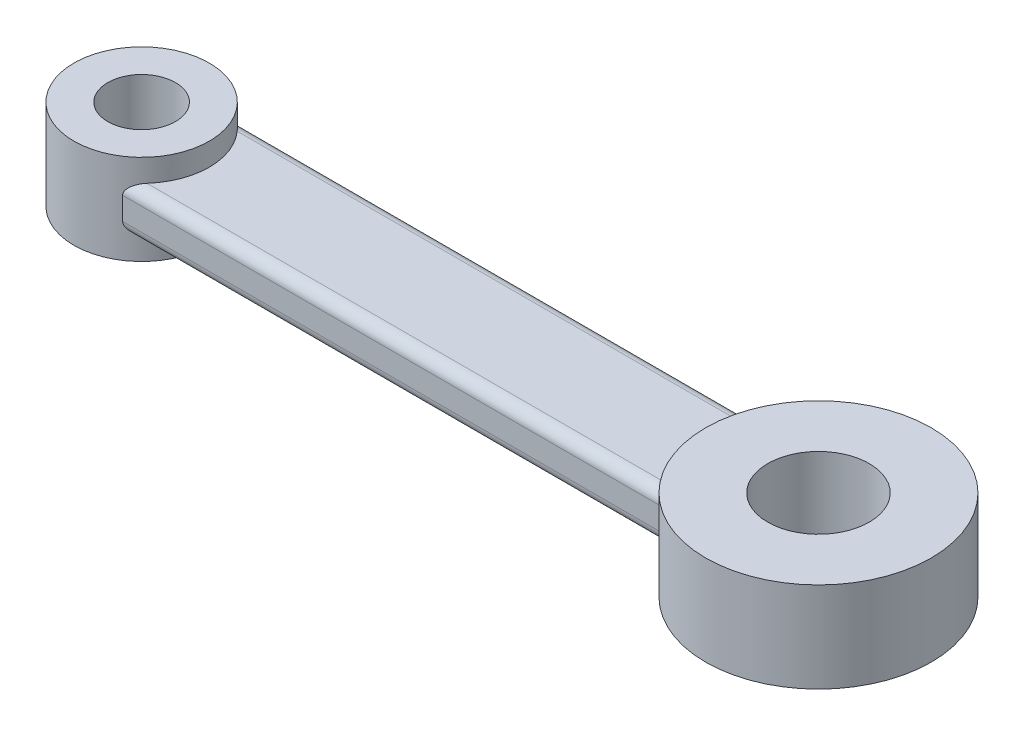
from build123d import *

# Parameters (mm, degrees)
SKETCH1_W                = 30
SKETCH1_H                = 5
BOSS_EXTRUDE2_DEPTH      = 1
BOSS_EXTRUDE3_DEPTH      = 1
BOSS_EXTRUDE3_DEPTH_BACK = 3
SKETCH2_R                = 3
SKETCH2_R_2              = 5
SKETCH3_R                = 1.5
SKETCH3_R_2              = 2.25
CUT_EXTRUDE1_DEPTH       = 41
FILLET1_R                = 0.5
FILLET2_R                = 0.5


with BuildPart() as part:
    # Sketch1 → Boss-Extrude2 (new, symmetric)
    with BuildSketch(Plane(origin=(0, 0, 0), x_dir=(1, 0, 0), z_dir=(0, 1, 0))):
        Rectangle(SKETCH1_W, SKETCH1_H)
    extrude(amount=BOSS_EXTRUDE2_DEPTH, both=True)

    # Sketch2 → Boss-Extrude3 (add, two sides: drawn at the far end of the back side and taken through both)
    with BuildSketch(Plane(origin=(0, 1, 0), x_dir=(1, 0, 0), z_dir=(0, 1, 0)).offset(-BOSS_EXTRUDE3_DEPTH_BACK)):
        with Locations(Location((-15, 0, 0), (0, 0, 270))):
            Circle(SKETCH2_R)
        with Locations(Location((15, 0, 0), (0, 0, 270))):
            Circle(SKETCH2_R_2)
    extrude(amount=BOSS_EXTRUDE3_DEPTH + BOSS_EXTRUDE3_DEPTH_BACK)

    # Sketch3 → Cut-Extrude1 (cut)
    with BuildSketch(Plane(origin=(0, 2, 0), x_dir=(1, 0, 0), z_dir=(0, 1, 0))):
        with Locations(Location((-15, 0, 0), (0, 0, 270))):
            Circle(SKETCH3_R)
        with Locations(Location((15, 0, 0), (0, 0, 270))):
            Circle(SKETCH3_R_2)
    extrude(amount=-CUT_EXTRUDE1_DEPTH, mode=Mode.SUBTRACT)

    # Fillet1
    # the kernel refuses this fillet: 0.5 mm, written as the material it takes off along each edge
    with BuildSketch(Plane(origin=(-14.591687605, 1, 2.5), x_dir=(0, -1, 0), z_dir=(1, 0, 0))) as fillet1_piece_1_section:
        with BuildLine():
            CenterArc((FILLET1_R, FILLET1_R), FILLET1_R, 180, 90)
            Line((0, FILLET1_R), (0, 0))
            Line((0, 0), (FILLET1_R, 0))
        make_face()
    fillet1_piece_1 = extrude(amount=26.511560586, mode=Mode.PRIVATE)
    fillet1_piece_1 = fillet1_piece_1 - Plane(origin=(-15, 0.886280148, 0), x_dir=(0, 0, 1), z_dir=(0, 1, 0)) * Cylinder(3, 56, mode=Mode.PRIVATE)
    fillet1_piece_1 = fillet1_piece_1 - Plane(origin=(15, 0.886280148, 0), x_dir=(0, 0, 1), z_dir=(0, 1, 0)) * Cylinder(5, 56, mode=Mode.PRIVATE)
    add(fillet1_piece_1, mode=Mode.SUBTRACT)
    with BuildSketch(Plane(origin=(11.919872981, 1, -2.5), x_dir=(0, 0, 1), z_dir=(-1, 0, 0))) as fillet1_piece_2_section:
        with BuildLine():
            CenterArc((FILLET1_R, -FILLET1_R), FILLET1_R, 90, 90)
            Line((0, -FILLET1_R), (0, 0))
            Line((0, 0), (FILLET1_R, 0))
        make_face()
    fillet1_piece_2 = extrude(amount=26.511560586, mode=Mode.PRIVATE)
    fillet1_piece_2 = fillet1_piece_2 - Plane(origin=(-15, 0.88627951, 0), x_dir=(0, 0, 1), z_dir=(0, 1, 0)) * Cylinder(3, 56, mode=Mode.PRIVATE)
    fillet1_piece_2 = fillet1_piece_2 - Plane(origin=(15, 0.88627951, 0), x_dir=(0, 0, 1), z_dir=(0, -1, 0)) * Cylinder(5, 56, mode=Mode.PRIVATE)
    add(fillet1_piece_2, mode=Mode.SUBTRACT)

    # Fillet2
    fillet2_edges = [part.edges().sort_by_distance(p)[0] for p in [
        (-1.335907312, -1, 2.5),
        (-1.335907312, -1, -2.5),
    ]]
    fillet(fillet2_edges, radius=FILLET2_R)


solid = part.part
